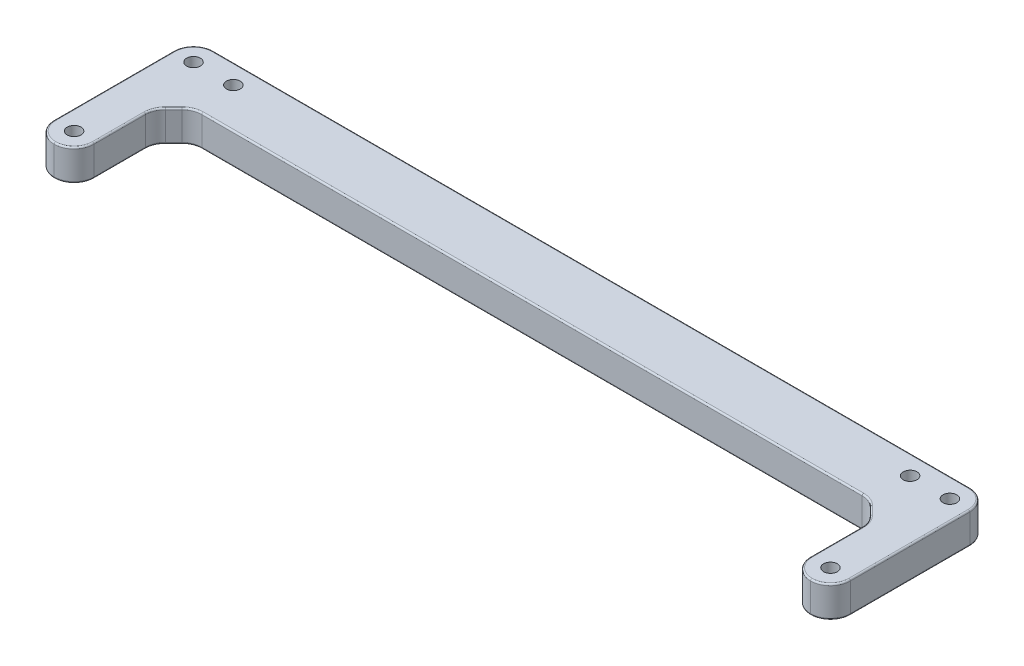
from build123d import *

# Parameters (mm, degrees)
SKETCH1_R           = 2.2
BOSS_EXTRUDE1_DEPTH = 10
FILLET1_R           = 6.35
FILLET2_R           = 6.35
FILLET3_R           = 0.5


with BuildPart() as part:
    # Sketch1 → Boss-Extrude1 (new body)
    with BuildSketch(Plane(origin=(0, 0, 0), x_dir=(1, 0, 0), z_dir=(0, 1, 0))):
        Polygon((127, 0), (-127, 0), (-127, -50.8), (-114.3, -50.8), (-114.3, -25.4), (-107.95, -19.05), (107.95, -19.05), (114.3, -25.4), (114.3, -50.8), (127, -50.8), align=None)
        with Locations(Location((-120.65, -6.35, 0), (0, 0, 270))):
            Circle(SKETCH1_R, mode=Mode.SUBTRACT)
        with Locations(Location((-107.95, -6.35, 0), (0, 0, 270))):
            Circle(SKETCH1_R, mode=Mode.SUBTRACT)
        with Locations(Location((-120.65, -44.45, 0), (0, 0, 270))):
            Circle(SKETCH1_R, mode=Mode.SUBTRACT)
        with Locations(Location((120.65, -44.45, 0), (0, 0, 90))):
            Circle(SKETCH1_R, mode=Mode.SUBTRACT)
        with Locations(Location((107.95, -6.35, 0), (0, 0, 90))):
            Circle(SKETCH1_R, mode=Mode.SUBTRACT)
        with Locations(Location((120.65, -6.35, 0), (0, 0, 90))):
            Circle(SKETCH1_R, mode=Mode.SUBTRACT)
    extrude(amount=BOSS_EXTRUDE1_DEPTH)

    # Fillet1
    fillet1_edges = [part.edges().sort_by_distance(p)[0] for p in [
        (127, 5, 0),
        (127, 5, 50.8),
        (114.3, 5, 50.8),
        (-114.3, 5, 50.8),
        (-127, 5, 50.8),
        (-127, 5, 0),
    ]]
    fillet(fillet1_edges, radius=FILLET1_R - 0.0001)  # a hair under: the kernel refuses the full size

    # Fillet2
    fillet2_edges = [part.edges().sort_by_distance(p)[0] for p in [
        (114.3, 5, 25.4),
        (107.95, 5, 19.05),
        (-107.95, 5, 19.05),
        (-114.3, 5, 25.4),
    ]]
    fillet(fillet2_edges, radius=FILLET2_R)

    # Fillet3
    fillet3_edges = [part.edges().sort_by_distance(p)[0] for p in [
        (0, 0, 0),
        (0, 10, 0),
        (-127, 0, 25.4),
        (127, 0, 25.4),
        (-114.3, 0, 36.240178061),
        (-125.14015735, 0, 1.85984265),
        (-125.14015735, 0, 48.94015735),
        (-116.15984265, 0, 48.94015735),
        (116.15984265, 0, 48.94015735),
        (125.14015735, 0, 48.94015735),
        (125.14015735, 0, 1.85984265),
        (127, 10, 25.4),
        (-127, 10, 25.4),
        (-114.3, 10, 36.240178061),
        (-125.14015735, 10, 1.85984265),
        (-125.14015735, 10, 48.94015735),
        (-116.15984265, 10, 48.94015735),
        (116.15984265, 10, 48.94015735),
        (125.14015735, 10, 48.94015735),
        (125.14015735, 10, 1.85984265),
        (114.3, 0, 36.240178061),
        (114.3, 10, 36.240178061),
        (111.125, 0, 22.225),
        (111.125, 10, 22.225),
        (0, 0, 19.05),
        (0, 10, 19.05),
        (-111.125, 0, 22.225),
        (-111.125, 10, 22.225),
        (113.816635031, 0, 25.600216326),
        (113.816635031, 10, 25.600216326),
        (107.749783674, 0, 19.533364969),
        (107.749783674, 10, 19.533364969),
        (-113.816635031, 0, 25.600216326),
        (-113.816635031, 10, 25.600216326),
        (-107.749783674, 0, 19.533364969),
        (-107.749783674, 10, 19.533364969),
    ]]
    fillet(fillet3_edges, radius=FILLET3_R)


solid = part.part
